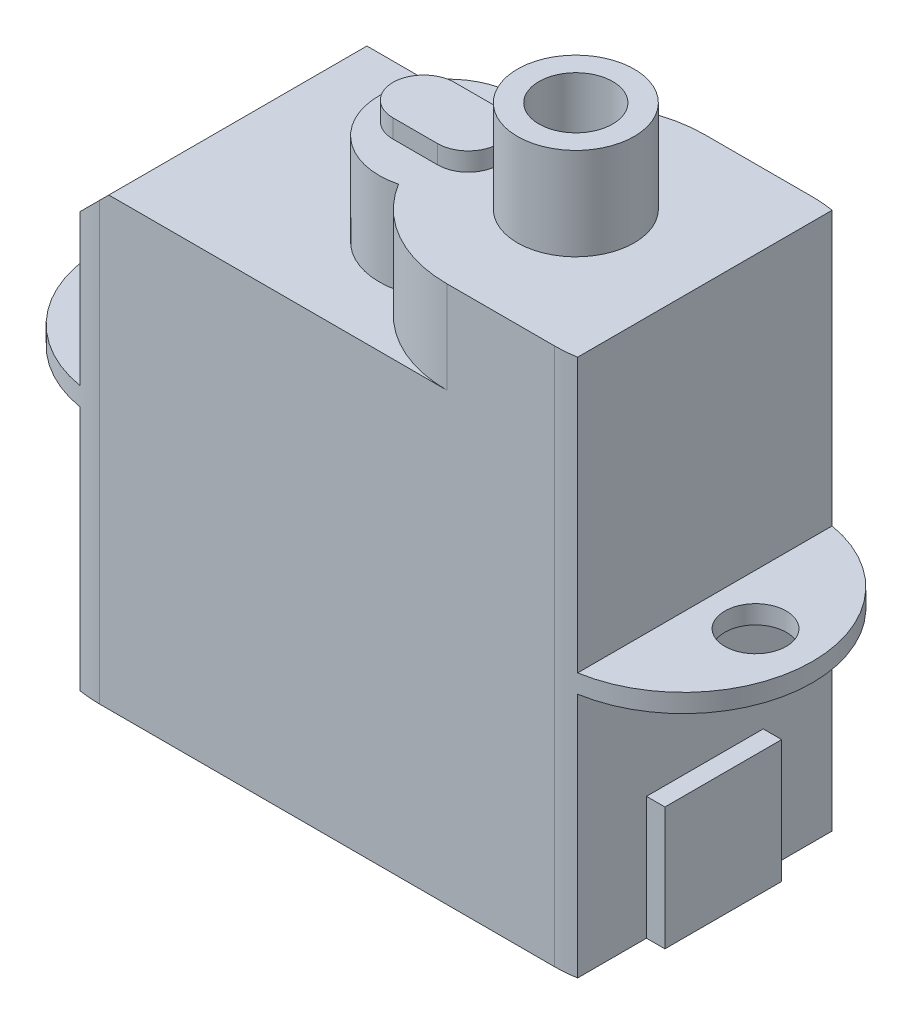
from build123d import *

# Parameters (mm, degrees)
SKETCH1_W                = 16.2
SKETCH1_H                = 8.4
BOSS_EXTRUDE1_DEPTH      = 14.5
SKETCH3_R                = 1.9
BOSS_EXTRUDE2_DEPTH      = 3
SKETCH3_3_R              = 1.9
BOSS_EXTRUDE3_DEPTH      = 6
SKETCH6_W                = 3.5
SKETCH6_H                = 8.4
SKETCH6_R                = 1
BOSS_EXTRUDE4_DEPTH      = 0.6
FILLET2_START            = -1
FILLET2_DEPTH            = 19
FILLET3_START            = -1
FILLET3_DEPTH            = 16
BOSS_EXTRUDE5_DEPTH      = 0.6
SKETCH8_W                = 3.8
SKETCH8_H                = 4
BOSS_EXTRUDE6_DEPTH      = 0.6
CHAMFER1_SIZE            = 1
M2_CLEARANCE_HOLE1_D     = 2.4
M2_CLEARANCE_HOLE1_DEPTH = 6
M2_CLEARANCE_HOLE1_TIP   = 0.721032743


with BuildPart() as part:
    # Sketch1 → Boss-Extrude1 (new body)
    with BuildSketch(Plane(origin=(0, 0, 0), x_dir=(1, 0, 0), z_dir=(0, 1, 0))):
        Rectangle(SKETCH1_W, SKETCH1_H)
    extrude(amount=BOSS_EXTRUDE1_DEPTH)

    # Sketch3 → Boss-Extrude2 (add)
    with BuildSketch(Plane(origin=(0, 14.5, 0), x_dir=(1, 0, 0), z_dir=(0, 1, 0))):
        with BuildLine():
            Line((3.9, 4.2), (8.1, 4.2))
            Line((8.1, 4.2), (8.1, -4.2))
            Line((8.1, -4.2), (3.9, -4.2))
            ThreePointArc((3.9, -4.2), (1.840026431, -3.660124164), (0.309638554, -2.179289951))
            ThreePointArc((0.309638554, -2.179289951), (-2.5, 0), (0.309638554, 2.179289951))
            ThreePointArc((0.309638554, 2.179289951), (1.840026431, 3.660124164), (3.9, 4.2))
        make_face()
        with Locations(Location((3.9, 0, 0), (0, 0, 270))):
            Circle(SKETCH3_R, mode=Mode.SUBTRACT)
    extrude(amount=BOSS_EXTRUDE2_DEPTH)

    # Sketch3<3> → Boss-Extrude3 (add)
    with BuildSketch(Plane(origin=(0, 14.5, 0), x_dir=(1, 0, 0), z_dir=(0, 1, 0))):
        with Locations(Location((3.9, 0, 0), (0, 0, 270))):
            Circle(SKETCH3_3_R)
    extrude(amount=BOSS_EXTRUDE3_DEPTH)

    # Sketch6 → Boss-Extrude4 (add)
    # profile 1 of 2: a face of its own
    with BuildSketch(Plane(origin=(0, 8, 0), x_dir=(1, 0, 0), z_dir=(0, 1, 0))):
        with Locations((9.85, 0)):
            Rectangle(SKETCH6_W, SKETCH6_H)
        with Locations(Location((9.75, 0, 0), (0, 0, 270))):
            Circle(SKETCH6_R, mode=Mode.SUBTRACT)
    # profile 2 of 2: a face of its own
    with BuildSketch(Plane(origin=(0, 8, 0), x_dir=(1, 0, 0), z_dir=(0, 1, 0))):
        with Locations((-9.85, 0)):
            Rectangle(SKETCH6_W, SKETCH6_H)
        with Locations(Location((-9.75, 0, 0), (0, 0, 90))):
            Circle(SKETCH6_R, mode=Mode.SUBTRACT)
    extrude(amount=BOSS_EXTRUDE4_DEPTH)

    # Fillet2: read off the stored shape, not the designer's step
    # Fillet2 outline → Fillet2 (cut)
    with BuildSketch(Plane(origin=(0, 0, 0), x_dir=(1, 0, 0), z_dir=(0, 1, 0)).offset(FILLET2_START)):
        with BuildLine():
            ThreePointArc((7.4, 4.2), (10.369848481, 2.969848481), (11.6, 0))
            Line((11.6, 0), (11.6, 4.2))
            Line((11.6, 4.2), (7.4, 4.2))
        make_face()
        with BuildLine():
            Line((11.6, -4.2), (11.6, 0))
            ThreePointArc((11.6, 0), (10.369848481, -2.969848481), (7.4, -4.2))
            Line((7.4, -4.2), (11.6, -4.2))
        make_face()
    extrude(amount=FILLET2_DEPTH, mode=Mode.SUBTRACT)

    # Fillet3: read off the stored shape, not the designer's step
    # Fillet3 outline → Fillet3 (cut)
    with BuildSketch(Plane(origin=(0, 0, 0), x_dir=(1, 0, 0), z_dir=(0, 1, 0)).offset(FILLET3_START)):
        with BuildLine():
            ThreePointArc((-7.4, -4.2), (-10.369848481, -2.969848481), (-11.6, 0))
            Line((-11.6, 0), (-11.6, -4.2))
            Line((-11.6, -4.2), (-7.4, -4.2))
        make_face()
        with BuildLine():
            Line((-11.6, 4.2), (-11.6, 0))
            ThreePointArc((-11.6, 0), (-10.369848481, 2.969848481), (-7.4, 4.2))
            Line((-7.4, 4.2), (-11.6, 4.2))
        make_face()
    extrude(amount=FILLET3_DEPTH, mode=Mode.SUBTRACT)

    # Sketch7 → Boss-Extrude5 (add)
    with BuildSketch(Plane(origin=(0, 17.5, 0), x_dir=(1, 0, 0), z_dir=(0, 1, 0))):
        with BuildLine():
            Line((-1.05, 1), (0.4, 1))
            ThreePointArc((0.4, 1), (1.4, 0), (0.4, -1))
            Line((0.4, -1), (-1.05, -1))
            ThreePointArc((-1.05, -1), (-2.05, 0), (-1.05, 1))
        make_face()
    extrude(amount=BOSS_EXTRUDE5_DEPTH)

    # Sketch8 → Boss-Extrude6 (add)
    with BuildSketch(Plane(origin=(8.1, 0, 0), x_dir=(0, 0, -1), z_dir=(1, 0, 0))):
        with Locations((0, 2)):
            Rectangle(SKETCH8_W, SKETCH8_H)
    extrude(amount=BOSS_EXTRUDE6_DEPTH)

    # Chamfer1
    chamfer1_edges = [part.edges().sort_by_distance(p)[0] for p in [
        (-8.1, 14.5, 0),
    ]]
    chamfer(chamfer1_edges, length=CHAMFER1_SIZE)

    # M2 Clearance Hole1
    with Locations(Plane(origin=(0, 20.5, 0), x_dir=(1, 0, 0), z_dir=(0, 1, 0))):
        with Locations((3.9, 0)):
            Hole(M2_CLEARANCE_HOLE1_D / 2, depth=M2_CLEARANCE_HOLE1_DEPTH)
            with Locations((0, 0, -(M2_CLEARANCE_HOLE1_DEPTH + M2_CLEARANCE_HOLE1_TIP / 2))):  # 118° drill point
                Cone(0, M2_CLEARANCE_HOLE1_D / 2, M2_CLEARANCE_HOLE1_TIP, mode=Mode.SUBTRACT)


solid = part.part
